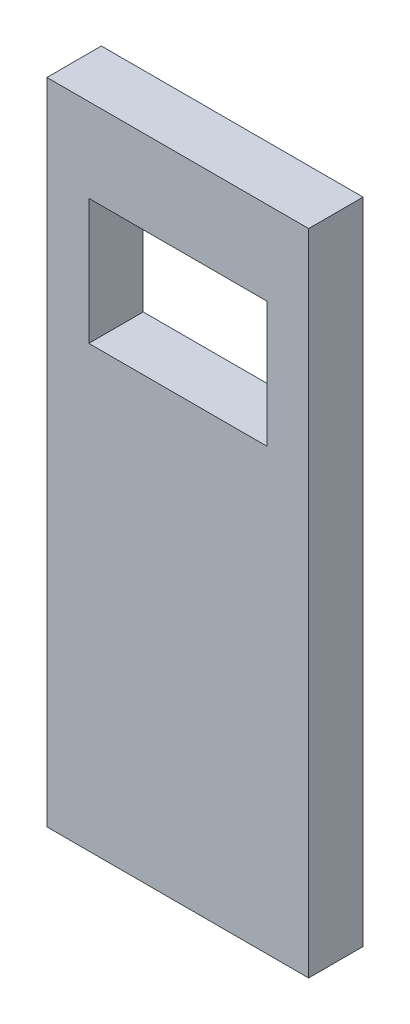
from build123d import *

# Parameters (mm, degrees)
SKETCH1_W           = 17
SKETCH1_H           = 12
BOSS_EXTRUDE1_DEPTH = 2.6


with BuildPart() as part:
    # Sketch1 → Boss-Extrude1 (new, symmetric)
    with BuildSketch(Plane.XY):
        Polygon((0, 62), (0, 42), (0, 37), (0, 25), (0, 20), (0, 0), (25, 0), (25, 20), (25, 25), (25, 37), (25, 42), (25, 62), align=None)
        with Locations((12.5, 48)):
            Rectangle(SKETCH1_W, SKETCH1_H, mode=Mode.SUBTRACT)
    extrude(amount=BOSS_EXTRUDE1_DEPTH, both=True)


solid = part.part
